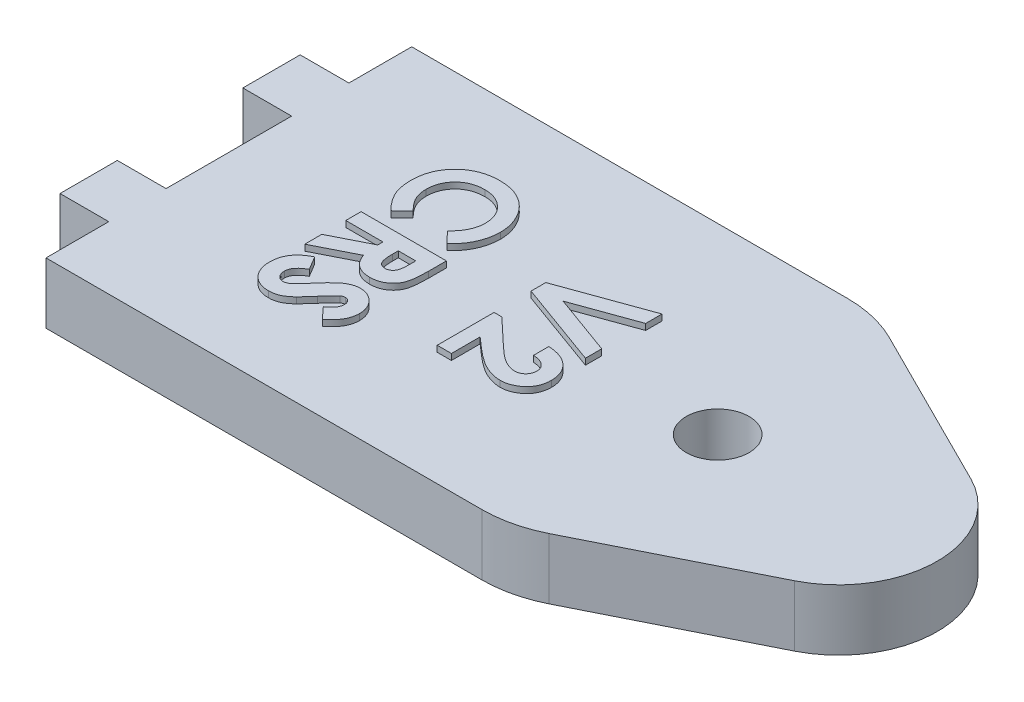
from build123d import *

# Parameters (mm, degrees)
BOSS_EXTRUDE2_DEPTH = 10
CUT_EXTRUDE2_DEPTH  = 10
FILLET3_R           = 16
SKETCH8_W           = 8
SKETCH8_H           = 0.3
CUT_EXTRUDE5_DEPTH  = 10
BOSS_EXTRUDE3_DEPTH = 10
FILLET4_R           = 20
SKETCH12_R          = 5.15
CUT_EXTRUDE6_DEPTH  = 10
BOSS_EXTRUDE4_DEPTH = 1


with BuildPart() as part:
    # Sketch1 → Boss-Extrude2 (new body)
    with BuildSketch(Plane(origin=(0, 0, 0), x_dir=(1, 0, 0), z_dir=(0, 1, 0))):
        Polygon((0, 0), (0, 10), (-8, 10), (-8, 20), (0, 20), (0, 40), (-8, 40), (-8, 50), (0, 50), (0, 60), (50, 60), (90, 40), (90, 20), (50, 0), align=None)
    extrude(amount=BOSS_EXTRUDE2_DEPTH)

    # Sketch5 → Cut-Extrude2 (cut)
    with BuildSketch(Plane(origin=(0, 10, 0), x_dir=(1, 0, 0), z_dir=(0, 1, 0))):
        with BuildLine():
            Line((90, 20), (90, 30))
            ThreePointArc((90, 30), (87.583479317, 21.493491916), (81.05572809, 15.527864045))
            Line((81.05572809, 15.527864045), (90, 20))
        make_face()
        with BuildLine():
            Line((90, 40), (81.05572809, 44.472135955))
            ThreePointArc((81.05572809, 44.472135955), (87.583479317, 38.506508084), (90, 30))
            Line((90, 30), (90, 40))
        make_face()
    extrude(amount=-CUT_EXTRUDE2_DEPTH, mode=Mode.SUBTRACT)

    # Fillet3
    fillet3_edges = [part.edges().sort_by_distance(p)[0] for p in [
        (50, 5, -60),
        (50, 5, 0),
    ]]
    fillet(fillet3_edges, radius=FILLET3_R)

    # Sketch8 → Cut-Extrude5 (cut)
    with BuildSketch(Plane(origin=(0, 10, 0), x_dir=(1, 0, 0), z_dir=(0, 1, 0))):
        with Locations((-4, 49.85)):
            Rectangle(SKETCH8_W, SKETCH8_H)
        with Locations((-4, 40.15)):
            Rectangle(SKETCH8_W, SKETCH8_H)
        with Locations((-4, 19.85)):
            Rectangle(SKETCH8_W, SKETCH8_H)
        with Locations((-4, 10.15)):
            Rectangle(SKETCH8_W, SKETCH8_H)
    extrude(amount=-CUT_EXTRUDE5_DEPTH, mode=Mode.SUBTRACT)

    # Sketch11 → Boss-Extrude3 (add)
    with BuildSketch(Plane.XZ):
        with BuildLine():
            Line((46.22291236, 0), (76.22291236, 0))
            Line((76.22291236, 0), (107.27864045, -15.527864045))
            ThreePointArc((107.27864045, -15.527864045), (116.22291236, -30), (107.27864045, -44.472135955))
            Line((107.27864045, -44.472135955), (76.22291236, -60))
            Line((76.22291236, -60), (46.22291236, -60))
            Line((46.22291236, -60), (46.22291236, 0))
        make_face()
    extrude(amount=-BOSS_EXTRUDE3_DEPTH)

    # Fillet4
    fillet4_edges = [part.edges().sort_by_distance(p)[0] for p in [
        (76.22291236, 5, 0),
        (76.22291236, 5, -60),
    ]]
    fillet(fillet4_edges, radius=FILLET4_R)

    # Sketch12 → Cut-Extrude6 (cut)
    with BuildSketch(Plane(origin=(0, 10, 0), x_dir=(1, 0, 0), z_dir=(0, 1, 0))):
        with Locations((80.20291236, 30)):
            Circle(SKETCH12_R)
    extrude(amount=-CUT_EXTRUDE6_DEPTH, mode=Mode.SUBTRACT)

    # Sketch13 → Boss-Extrude4 (add)
    # profile 1 of 5: a face of its own
    with BuildSketch(Plane(origin=(0, 10, 0), x_dir=(1, 0, 0), z_dir=(0, 1, 0))):
        Polygon((59.505371797, 41.564456878), (59.505371797, 38.880562647), (49.560660259, 35.282405596), (59.505371797, 31.675835083), (59.505371797, 29.000354313), (45.505371797, 34.076476108), (45.505371797, 36.496748544), align=None)
    # profile 2 of 5: a face of its own
    with BuildSketch(Plane(origin=(0, 10, 0), x_dir=(1, 0, 0), z_dir=(0, 1, 0))):
        with BuildLine():
            Line((54.83870513, 25.141379954), (54.83870513, 27.654200467))
            add(Edge.make_bspline(
                [(54.83870513, 27.654200467), (55.028786708, 27.643347981), (55.400194699, 27.622142874), (55.939676698, 27.537794318), (56.449427863, 27.424770149), (56.92766503, 27.27392439), (57.374214421, 27.084376824), (57.790598349, 26.861004999), (58.174624543, 26.59810227), (58.524441011, 26.301264074), (58.838264593, 25.975529906), (59.116520296, 25.627662327), (59.346129899, 25.252340234), (59.535077344, 24.856421069), (59.686037574, 24.439972247), (59.786966703, 23.999053511), (59.855316898, 23.537482572), (59.861297815, 23.221499887), (59.864346156, 23.060450467)],
                knots=[0, 0, 0, 0, 1.199038563, 2.342849363, 3.436047546, 4.486744587, 5.497670872, 6.488682221, 7.459191391, 8.424610317, 9.374430501, 10.305433194, 11.225809216, 12.140057399, 13.06607119, 14.010487599, 14.985989317, 16, 16, 16, 16], degree=3))
            add(Edge.make_bspline(
                [(59.864346156, 23.060450467), (59.858167788, 22.862768929), (59.846106166, 22.47684824), (59.74352409, 21.916001983), (59.570933664, 21.391710381), (59.332186737, 20.903957215), (59.027478674, 20.458597505), (58.660982614, 20.058532413), (58.233974145, 19.706260718), (57.75516208, 19.408525065), (57.247369119, 19.165188602), (56.724427945, 18.991171965), (56.197236124, 18.877550655), (55.842336951, 18.865376562), (55.666028848, 18.859328672)],
                knots=[0, 0, 0, 0, 1.075208937, 2.099059817, 3.090102131, 4.070747506, 5.044426497, 6.016695572, 7.013986309, 8.047248753, 9.078128699, 10.07077592, 11.041593041, 12, 12, 12, 12], degree=3))
            add(Edge.make_bspline(
                [(55.666028848, 18.859328672), (55.55938108, 18.861677464), (55.344725467, 18.866405002), (55.019898842, 18.899276209), (54.689024935, 18.948589494), (54.352387504, 19.022941992), (54.00989193, 19.115665345), (53.660514233, 19.228153374), (53.306231368, 19.363009651), (52.943071275, 19.518005968), (52.569793439, 19.702842389), (52.181055864, 19.918365421), (51.775712952, 20.169040669), (51.35672672, 20.457589385), (50.915015483, 20.772300735), (50.461951729, 21.128100478), (49.990115024, 21.514573458), (49.674922053, 21.789164361), (49.512983977, 21.930242134)],
                knots=[0, 0, 0, 0, 0.728291422, 1.465870735, 2.227967504, 3.011895603, 3.818808047, 4.650669213, 5.517493715, 6.406970765, 7.346374078, 8.360901659, 9.441709605, 10.599840149, 11.834858619, 13.145178554, 14.533265854, 16, 16, 16, 16], degree=3))
            Line((49.512983977, 21.930242134), (47.83870513, 23.391379954))
            Line((47.83870513, 23.391379954), (47.83870513, 18.679841493))
            Line((47.83870513, 18.679841493), (45.505371797, 18.679841493))
            Line((45.505371797, 18.679841493), (45.505371797, 28.013174826))
            Line((45.505371797, 28.013174826), (46.778608977, 28.013174826))
            Line((46.778608977, 28.013174826), (51.19006731, 23.868142775))
            add(Edge.make_bspline(
                [(51.19006731, 23.868142775), (51.318750919, 23.748133445), (51.567972909, 23.515710963), (51.933981915, 23.184997723), (52.281315725, 22.885731455), (52.613672744, 22.624117687), (52.920272662, 22.386427266), (53.210356784, 22.18325879), (53.481302644, 22.012753425), (53.808016031, 21.827645669), (54.197679884, 21.651854149), (54.64658862, 21.490554791), (55.075641985, 21.39223167), (55.35522238, 21.37865997), (55.489346156, 21.372149185)],
                knots=[0, 0, 0, 0, 1.246127091, 2.413378631, 3.493388633, 4.492180848, 5.408488754, 6.240484944, 6.999099869, 7.674939598, 8.898438119, 10.020720584, 11.050475521, 12, 12, 12, 12], degree=3))
            add(Edge.make_bspline(
                [(55.489346156, 21.372149185), (55.619139166, 21.376941127), (55.870633933, 21.386226282), (56.227343096, 21.490805999), (56.552757691, 21.647283095), (56.832054187, 21.874458171), (57.063565005, 22.148652679), (57.233213337, 22.467312262), (57.332923705, 22.82458608), (57.345206806, 23.074774201), (57.351525643, 23.203479313)],
                knots=[0, 0, 0, 0, 1.061596218, 2.057012874, 3.024113775, 4.006148568, 4.986025304, 5.949989669, 6.945406325, 8, 8, 8, 8], degree=3))
            add(Edge.make_bspline(
                [(57.351525643, 23.203479313), (57.349174364, 23.269956901), (57.344545493, 23.400828709), (57.313732353, 23.593200037), (57.25942741, 23.776255176), (57.18666643, 23.952031632), (57.090221228, 24.118653473), (56.971337151, 24.275700425), (56.833035313, 24.424827176), (56.675748167, 24.565349772), (56.500215665, 24.693243678), (56.308040939, 24.806838578), (56.099343276, 24.90076265), (55.876877805, 24.983456817), (55.638255066, 25.047234515), (55.384903188, 25.093672591), (55.117234342, 25.128976359), (54.93323718, 25.137170208), (54.83870513, 25.141379954)],
                knots=[0, 0, 0, 0, 0.903469896, 1.778625579, 2.63899355, 3.493148037, 4.358286772, 5.247621495, 6.164656832, 7.118446693, 8.109501108, 9.111810964, 10.146451449, 11.215617525, 12.33435995, 13.498009769, 14.714554818, 16, 16, 16, 16], degree=3))
        make_face()
    # profile 3 of 5: a face of its own
    with BuildSketch(Plane(origin=(0, 10, 0), x_dir=(1, 0, 0), z_dir=(0, 1, 0))):
        with BuildLine():
            Line((31.845916669, 33.936251749), (30.08469872, 35.778799826))
            add(Edge.make_bspline(
                [(30.08469872, 35.778799826), (30.246520663, 35.934932404), (30.563124164, 36.240404702), (30.978055356, 36.734726681), (31.32923085, 37.244212545), (31.621325956, 37.765436276), (31.844150608, 38.306441714), (32.004350008, 38.860108353), (32.10410361, 39.429446), (32.115174631, 39.814054698), (32.120756412, 40.007966493)],
                knots=[0, 0, 0, 0, 1.115306757, 2.182089883, 3.196083701, 4.1824169, 5.141279108, 6.092660653, 7.038358735, 8, 8, 8, 8], degree=3))
            add(Edge.make_bspline(
                [(32.120756412, 40.007966493), (32.116273706, 40.16989101), (32.107427578, 40.489431204), (32.042576738, 40.958599943), (31.932295061, 41.40738409), (31.780306482, 41.837319903), (31.583641327, 42.247142278), (31.342451811, 42.637710457), (31.058916218, 43.008061513), (30.734501574, 43.35330332), (30.380054196, 43.669118393), (30.00185969, 43.948161119), (29.600784477, 44.181904163), (29.180890353, 44.373733277), (28.740233839, 44.523160741), (28.279111604, 44.629870725), (27.796974487, 44.691588927), (27.469221266, 44.700800783), (27.302647438, 44.705482519)],
                knots=[0, 0, 0, 0, 1.035432265, 2.043311493, 3.022114605, 3.98653278, 4.95457646, 5.923598177, 6.917315552, 7.932509744, 8.948865224, 9.949768934, 10.933144597, 11.912367597, 12.897413939, 13.903909035, 14.934704909, 16, 16, 16, 16], degree=3))
            add(Edge.make_bspline(
                [(27.302647438, 44.705482519), (27.185733678, 44.704135014), (26.955294255, 44.701479055), (26.614420633, 44.672343118), (26.283653024, 44.625558079), (25.963676969, 44.557388158), (25.653254389, 44.473665831), (25.352468658, 44.369616281), (25.061500504, 44.246047475), (24.780898646, 44.106460209), (24.513900621, 43.948922478), (24.260444474, 43.775080938), (24.023757302, 43.583232069), (23.795742645, 43.382339056), (23.590016163, 43.158793077), (23.39465026, 42.922979087), (23.216288374, 42.669875857), (23.050091482, 42.405146654), (22.905733718, 42.126393332), (22.774968228, 41.841209102), (22.668768502, 41.545261882), (22.583161489, 41.242157172), (22.510365607, 40.932977579), (22.465542924, 40.614699197), (22.431599238, 40.290081059), (22.429503413, 40.070693686), (22.42844872, 39.960290211)],
                knots=[0, 0, 0, 0, 1.103757074, 2.175527871, 3.227929046, 4.25632503, 5.262816555, 6.262237806, 7.259082723, 8.246028863, 9.219500025, 10.184246818, 11.145149257, 12.095245763, 13.050780899, 14.010384931, 14.985255937, 15.972438916, 16.959582425, 17.947317807, 18.933039374, 19.924907969, 20.920697008, 21.929431285, 22.958016685, 24, 24, 24, 24], degree=3))
            add(Edge.make_bspline(
                [(22.42844872, 39.960290211), (22.433873442, 39.773029688), (22.444531611, 39.405111455), (22.527637887, 38.865091531), (22.665180162, 38.349844984), (22.825977628, 37.937506755), (22.985182132, 37.615026594), (23.134494861, 37.371739367), (23.298642307, 37.118490096), (23.48774224, 36.86088033), (23.69810034, 36.596093587), (23.934612991, 36.328975741), (24.189408887, 36.052638195), (24.371265275, 35.871614187), (24.464506412, 35.778799826)],
                knots=[0, 0, 0, 0, 1.404522537, 2.759521553, 4.088271485, 5.398566954, 6.072955186, 6.783849712, 7.538645654, 8.336900766, 9.180343671, 10.075042757, 11.013038782, 12, 12, 12, 12], degree=3))
            Line((24.464506412, 35.778799826), (22.588304489, 33.992341493))
            add(Edge.make_bspline(
                [(22.588304489, 33.992341493), (22.467062477, 34.117919897), (22.230423997, 34.363022084), (21.894419518, 34.732751957), (21.592481843, 35.102016412), (21.313653339, 35.461895227), (21.066052212, 35.818282061), (20.849447735, 36.171144421), (20.658303683, 36.516469297), (20.496044932, 36.861492367), (20.357391094, 37.20895245), (20.2404573, 37.566301687), (20.138382112, 37.933710823), (20.058054203, 38.314222753), (19.992661725, 38.70613967), (19.949451815, 39.110720945), (19.919488462, 39.52607624), (19.91692546, 39.806922854), (19.915628207, 39.949072262)],
                knots=[0, 0, 0, 0, 1.244537013, 2.429070097, 3.56066612, 4.644477994, 5.67429546, 6.652817684, 7.595405349, 8.486886006, 9.369351459, 10.26090686, 11.166404474, 12.086719576, 13.0323422, 13.998023148, 14.9867073, 16, 16, 16, 16], degree=3))
            add(Edge.make_bspline(
                [(19.915628207, 39.949072262), (19.92229595, 40.210173053), (19.93534287, 40.721074722), (20.031678928, 41.469859982), (20.194250932, 42.181776015), (20.421049042, 42.858102027), (20.715545181, 43.496768179), (21.072882408, 44.099777338), (21.49645224, 44.666125307), (21.979943874, 45.190938719), (22.514032133, 45.66550868), (23.087276653, 46.085447755), (23.703794048, 46.431293549), (24.35037812, 46.72472593), (25.037137472, 46.944608926), (25.757866445, 47.104664366), (26.51565793, 47.202057267), (27.033126259, 47.212816005), (27.297038464, 47.218303031)],
                knots=[0, 0, 0, 0, 1.07798487, 2.109316747, 3.111276023, 4.08905949, 5.049398091, 6.009992678, 6.978127636, 7.964347882, 8.951383687, 9.924270623, 10.892397886, 11.86520058, 12.851549246, 13.863953586, 14.910602472, 16, 16, 16, 16], degree=3))
            add(Edge.make_bspline(
                [(27.297038464, 47.218303031), (27.469148197, 47.215883415), (27.810227624, 47.211088327), (28.313120589, 47.164691275), (28.801926179, 47.091714896), (29.275140707, 46.991364908), (29.735401133, 46.86190892), (30.179676487, 46.702806572), (30.609807735, 46.513354943), (31.023044597, 46.294390063), (31.421677426, 46.051966384), (31.798754632, 45.780011679), (32.158331913, 45.486858332), (32.495729181, 45.165279133), (32.812273806, 44.819653081), (33.111847422, 44.450932291), (33.388837562, 44.054660898), (33.644604875, 43.636537138), (33.878237868, 43.203125814), (34.07911854, 42.757457783), (34.251822669, 42.303631681), (34.392346678, 41.841842045), (34.498055808, 41.369948849), (34.577904597, 40.891759565), (34.622577381, 40.403312255), (34.629887052, 40.075358365), (34.633576925, 39.909809442)],
                knots=[0, 0, 0, 0, 1.072042128, 2.124525481, 3.143421661, 4.149789678, 5.136208088, 6.119957821, 7.087418232, 8.061778743, 9.031690376, 9.991741907, 10.955971237, 11.919971873, 12.892764515, 13.874218568, 14.877632952, 15.902487591, 16.926514439, 17.94307752, 18.945815567, 19.949956505, 20.947454389, 21.956649761, 22.968530506, 24, 24, 24, 24], degree=3))
            add(Edge.make_bspline(
                [(34.633576925, 39.909809442), (34.631461333, 39.768579513), (34.627252145, 39.487588053), (34.592163983, 39.069144617), (34.53705838, 38.654047696), (34.453915759, 38.243783464), (34.355214963, 37.835417291), (34.225979883, 37.434315568), (34.081923033, 37.034150697), (33.909732484, 36.64119867), (33.721770945, 36.254910984), (33.508521753, 35.884337036), (33.283108026, 35.523254924), (33.032188791, 35.179666011), (32.764865355, 34.847134136), (32.479890504, 34.527398137), (32.172512872, 34.223263886), (31.95533243, 34.032406117), (31.845916669, 33.936251749)],
                knots=[0, 0, 0, 0, 0.996412454, 1.982464992, 2.961075852, 3.949442424, 4.934965278, 5.923860011, 6.921385422, 7.934793307, 8.949617135, 9.951082467, 10.950285876, 11.951772932, 12.951063433, 13.960125323, 14.972308753, 16, 16, 16, 16], degree=3))
        make_face()
    # profile 4 of 5: a face of its own
    with BuildSketch(Plane(origin=(0, 10, 0), x_dir=(1, 0, 0), z_dir=(0, 1, 0))):
        with BuildLine():
            Line((34.274602566, 31.423431237), (34.274602566, 28.495546621))
            add(Edge.make_bspline(
                [(34.274602566, 28.495546621), (34.273917747, 28.30201403), (34.272600647, 27.929796341), (34.251728366, 27.393083723), (34.222815484, 26.900021837), (34.178153218, 26.449036281), (34.120399602, 26.041911388), (34.050332726, 25.677784872), (33.971176219, 25.356445291), (33.874157646, 25.07355272), (33.762430012, 24.8189605), (33.636321652, 24.58230926), (33.491067351, 24.359427505), (33.332552736, 24.146224286), (33.155100384, 23.94650517), (32.960148335, 23.760823531), (32.7491018, 23.586791818), (32.523229854, 23.424179727), (32.282847816, 23.27947354), (32.031368915, 23.151270997), (31.768113596, 23.045940569), (31.494588938, 22.958237367), (31.210466025, 22.89071124), (30.915929324, 22.844863495), (30.610853628, 22.810963286), (30.403574875, 22.809031862), (30.297839746, 22.808046621)],
                knots=[0, 0, 0, 0, 1.749037589, 3.363891962, 4.853828513, 6.212420965, 7.458679178, 8.568887289, 9.562757098, 10.447168552, 11.268163578, 12.073310924, 12.867792413, 13.67045336, 14.472446998, 15.279188696, 16.101356728, 16.943088626, 17.792208908, 18.634830833, 19.491484118, 20.351879174, 21.228996054, 22.12769993, 23.044919519, 24, 24, 24, 24], degree=3))
            add(Edge.make_bspline(
                [(30.297839746, 22.808046621), (30.187478711, 22.81062247), (29.971080837, 22.81567324), (29.65321001, 22.842879434), (29.349093436, 22.89260381), (29.059621532, 22.967918613), (28.781191482, 23.054483195), (28.518940495, 23.169591885), (28.269054511, 23.299503419), (28.035068261, 23.453795552), (27.811784443, 23.62312363), (27.607757889, 23.820048623), (27.412022943, 24.031812815), (27.236839779, 24.270320245), (27.070363145, 24.525057282), (26.91949098, 24.801085284), (26.780430705, 25.096602797), (26.70288109, 25.304366243), (26.663224361, 25.410610724)],
                knots=[0, 0, 0, 0, 1.099860209, 2.156625411, 3.176576793, 4.16617041, 5.135385252, 6.078461593, 7.016046972, 7.938469504, 8.868247731, 9.803980173, 10.76021508, 11.73834243, 12.748633912, 13.790971185, 14.870363756, 16, 16, 16, 16], degree=3))
            Line((26.663224361, 25.410610724), (20.274602566, 22.179841493))
            Line((20.274602566, 22.179841493), (20.274602566, 24.973110724))
            Line((20.274602566, 24.973110724), (26.377166669, 28.058046621))
            Line((26.377166669, 28.058046621), (26.377166669, 28.910610724))
            Line((26.377166669, 28.910610724), (20.274602566, 28.910610724))
            Line((20.274602566, 28.910610724), (20.274602566, 31.423431237))
            Line((20.274602566, 31.423431237), (34.274602566, 31.423431237))
        make_face()
        with BuildLine():
            Line((28.889987182, 28.910610724), (28.889987182, 27.931844698))
            add(Edge.make_bspline(
                [(28.889987182, 27.931844698), (28.891334879, 27.812182396), (28.89391543, 27.5830548), (28.905885526, 27.253539528), (28.934726073, 26.954260013), (28.97116884, 26.683935653), (29.013235346, 26.441191399), (29.073559734, 26.228239622), (29.138081089, 26.041649268), (29.218648721, 25.884099403), (29.308660406, 25.748943107), (29.41542757, 25.635654523), (29.532385335, 25.535851355), (29.666895081, 25.457564887), (29.81344597, 25.394314466), (29.974795216, 25.355088597), (30.148021397, 25.323966585), (30.268696716, 25.321927981), (30.331493592, 25.320867134)],
                knots=[0, 0, 0, 0, 1.688935225, 3.233948049, 4.651771667, 5.929878493, 7.083962697, 8.124219224, 9.050753627, 9.864999381, 10.615157594, 11.334035464, 12.05533055, 12.777108108, 13.522027315, 14.29964284, 15.115170198, 16, 16, 16, 16], degree=3))
            add(Edge.make_bspline(
                [(30.331493592, 25.320867134), (30.405690205, 25.32371725), (30.551435703, 25.329315776), (30.761255235, 25.384873627), (30.955468721, 25.473302819), (31.133144313, 25.594540117), (31.289067647, 25.747128712), (31.425396294, 25.921940231), (31.535709854, 26.121553533), (31.60636013, 26.307696195), (31.649786358, 26.478224476), (31.680613368, 26.631620576), (31.70451542, 26.809736804), (31.727654365, 27.011579284), (31.743581483, 27.238016028), (31.754850736, 27.488628839), (31.75952673, 27.763559353), (31.761008633, 27.955215068), (31.761782053, 28.055242134)],
                knots=[0, 0, 0, 0, 1.020213939, 2.004021227, 2.966357326, 3.948562114, 4.950324333, 5.960000531, 6.991850424, 8.080015304, 8.69218159, 9.414443227, 10.233931419, 11.166782034, 12.212677862, 13.359889063, 14.622099264, 16, 16, 16, 16], degree=3))
            Line((31.761782053, 28.055242134), (31.761782053, 28.910610724))
            Line((31.761782053, 28.910610724), (28.889987182, 28.910610724))
        make_face(mode=Mode.SUBTRACT)
    # profile 5 of 5: a face of its own
    with BuildSketch(Plane(origin=(0, 10, 0), x_dir=(1, 0, 0), z_dir=(0, 1, 0))):
        with BuildLine():
            Line((32.404009618, 12.936251749), (30.684858977, 14.81525816))
            add(Edge.make_bspline(
                [(30.684858977, 14.81525816), (30.798416766, 14.895731249), (31.016431886, 15.050228359), (31.308040587, 15.300903783), (31.558436443, 15.5500816), (31.760460347, 15.802856502), (31.923095955, 16.054876502), (32.035272292, 16.311495897), (32.107413565, 16.569762459), (32.116353153, 16.74336885), (32.120756412, 16.828879954)],
                knots=[0, 0, 0, 0, 1.299459705, 2.494781419, 3.587730629, 4.594196874, 5.512431013, 6.380462003, 7.202284646, 8, 8, 8, 8], degree=3))
            add(Edge.make_bspline(
                [(32.120756412, 16.828879954), (32.117959389, 16.908635565), (32.112559071, 17.062622694), (32.058880315, 17.282142771), (31.966238666, 17.477035821), (31.845101916, 17.647111639), (31.699160216, 17.781836778), (31.546104898, 17.889404355), (31.37716644, 17.949973939), (31.261132693, 17.957946088), (31.203689105, 17.961892775)],
                knots=[0, 0, 0, 0, 1.185010067, 2.2879431, 3.333075148, 4.379039566, 5.372662701, 6.27520591, 7.14612461, 8, 8, 8, 8], degree=3))
            add(Edge.make_bspline(
                [(31.203689105, 17.961892775), (31.145417155, 17.959419587), (31.028065545, 17.954438929), (30.856072146, 17.906332553), (30.688014574, 17.833822509), (30.585709933, 17.764536202), (30.533416669, 17.729120339)],
                knots=[0, 0, 0, 0, 0.967525499, 1.948461899, 2.951351359, 4, 4, 4, 4], degree=3))
            add(Edge.make_bspline(
                [(30.533416669, 17.729120339), (30.492774553, 17.69691878), (30.399221771, 17.622795045), (30.250916901, 17.481586679), (30.070456482, 17.304006957), (29.858828999, 17.08640882), (29.618791648, 16.829059232), (29.348940377, 16.52968058), (29.047581414, 16.192502595), (28.837441914, 15.953117812), (28.727326925, 15.827678031)],
                knots=[0, 0, 0, 0, 0.473868417, 1.090782513, 1.870421581, 2.78911798, 3.865477667, 5.087766164, 6.473963263, 8, 8, 8, 8], degree=3))
            add(Edge.make_bspline(
                [(28.727326925, 15.827678031), (28.625405872, 15.70991143), (28.431980886, 15.486414886), (28.157445176, 15.168423687), (27.910452092, 14.888962384), (27.694708471, 14.643959863), (27.507950669, 14.437130125), (27.349285986, 14.267603655), (27.221803331, 14.133309975), (27.14480373, 14.056971882), (27.11194231, 14.024392775)],
                knots=[0, 0, 0, 0, 1.543621617, 2.929473131, 4.163658386, 5.240097082, 6.164993805, 6.925417477, 7.541396219, 8, 8, 8, 8], degree=3))
            add(Edge.make_bspline(
                [(27.11194231, 14.024392775), (26.978230422, 13.900723969), (26.721189215, 13.662989094), (26.321677405, 13.354811597), (25.934346372, 13.097313695), (25.547294901, 12.900193538), (25.155873941, 12.755904857), (24.753343578, 12.650224539), (24.332794817, 12.587819851), (24.045908932, 12.580818576), (23.900804489, 12.57727739)],
                knots=[0, 0, 0, 0, 1.20648512, 2.3192881, 3.339983362, 4.284774958, 5.190427137, 6.099526693, 7.038756749, 8, 8, 8, 8], degree=3))
            add(Edge.make_bspline(
                [(23.900804489, 12.57727739), (23.759411909, 12.579785119), (23.481994403, 12.584705377), (23.07601638, 12.644903848), (22.687549808, 12.730866016), (22.320486556, 12.863323659), (21.970475826, 13.026124268), (21.637402887, 13.224539939), (21.329032477, 13.467119178), (21.037086962, 13.73656802), (20.774909831, 14.039212272), (20.544231446, 14.364847557), (20.347931267, 14.712865811), (20.192462854, 15.084565436), (20.067620513, 15.477671156), (19.978908799, 15.892679923), (19.924089862, 16.330077087), (19.918489398, 16.62866151), (19.915628207, 16.781203672)],
                knots=[0, 0, 0, 0, 1.043082113, 2.046565928, 3.024368146, 3.976196322, 4.921091788, 5.871642728, 6.831173094, 7.81279273, 8.801063391, 9.781590382, 10.755046466, 11.74476232, 12.751114423, 13.796272686, 14.874149815, 16, 16, 16, 16], degree=3))
            add(Edge.make_bspline(
                [(19.915628207, 16.781203672), (19.917751721, 16.900940989), (19.921957495, 17.138089546), (19.956315637, 17.487605694), (20.011712693, 17.825122093), (20.091299445, 18.15017003), (20.191224455, 18.463712552), (20.315575137, 18.765458221), (20.461937351, 19.055087524), (20.630394349, 19.334465393), (20.825884566, 19.60166616), (21.044343105, 19.860282113), (21.290505502, 20.107082991), (21.559570908, 20.347130683), (21.85843481, 20.571937508), (22.178476019, 20.793030168), (22.527239014, 20.999706652), (22.771854115, 21.127425866), (22.896798079, 21.192662006)],
                knots=[0, 0, 0, 0, 1.016957334, 2.014158747, 2.980235577, 3.920141478, 4.854360818, 5.773095257, 6.689355356, 7.608638744, 8.541033765, 9.498850575, 10.481527934, 11.499755671, 12.559141621, 13.65604909, 14.802761907, 16, 16, 16, 16], degree=3))
            Line((22.896798079, 21.192662006), (24.223320515, 18.982726108))
            add(Edge.make_bspline(
                [(24.223320515, 18.982726108), (24.08148846, 18.901130866), (23.809584288, 18.744705812), (23.444246572, 18.479628935), (23.131395293, 18.208071207), (22.876560117, 17.923754457), (22.67633357, 17.63013587), (22.533237788, 17.3257972), (22.444661662, 17.010524625), (22.433844471, 16.795775269), (22.42844872, 16.688655596)],
                knots=[0, 0, 0, 0, 1.283663364, 2.460892379, 3.537111102, 4.529833553, 5.449777664, 6.316464042, 7.160231139, 8, 8, 8, 8], degree=3))
            add(Edge.make_bspline(
                [(22.42844872, 16.688655596), (22.43281331, 16.579679487), (22.441281251, 16.368249964), (22.521040671, 16.065964558), (22.643460859, 15.787603222), (22.821502199, 15.548283164), (23.024521114, 15.345054428), (23.25349448, 15.19936031), (23.498264173, 15.104853626), (23.669067081, 15.095035738), (23.754971156, 15.090097903)],
                knots=[0, 0, 0, 0, 1.13537643, 2.202795631, 3.242191317, 4.290390765, 5.297919085, 6.223733717, 7.106639842, 8, 8, 8, 8], degree=3))
            add(Edge.make_bspline(
                [(23.754971156, 15.090097903), (23.834850808, 15.094719858), (23.997118673, 15.104108917), (24.238524962, 15.172889452), (24.478760682, 15.281316693), (24.677894006, 15.405749688), (24.843879913, 15.535477787), (24.985536664, 15.662636176), (25.145317076, 15.81334086), (25.318864111, 15.991431878), (25.509514526, 16.193445388), (25.716815033, 16.420042741), (25.939075828, 16.673664179), (26.090471501, 16.852931516), (26.169634618, 16.946668416)],
                knots=[0, 0, 0, 0, 0.916057066, 1.860882232, 2.859899639, 3.934694552, 4.546382938, 5.276161949, 6.118633209, 7.067046139, 8.129668089, 9.306861125, 10.591787583, 12, 12, 12, 12], degree=3))
            add(Edge.make_bspline(
                [(26.169634618, 16.946668416), (26.320411214, 17.124859172), (26.609797138, 17.466861166), (27.037124717, 17.950242047), (27.436804874, 18.385499917), (27.812009292, 18.769768266), (28.160423183, 19.104071835), (28.478727485, 19.392459707), (28.773379745, 19.628652255), (29.12296448, 19.876949709), (29.546719194, 20.116657021), (30.059261633, 20.319973503), (30.570646472, 20.45262127), (30.914067058, 20.46742634), (31.083096156, 20.474713288)],
                knots=[0, 0, 0, 0, 1.34561873, 2.582649632, 3.719171478, 4.751946187, 5.678152813, 6.502542634, 7.227205346, 7.853698961, 8.973370308, 10.023159194, 11.027013428, 12, 12, 12, 12], degree=3))
            add(Edge.make_bspline(
                [(31.083096156, 20.474713288), (31.202954341, 20.471671613), (31.439087842, 20.465679188), (31.786327527, 20.41238223), (32.121229927, 20.332361837), (32.443693088, 20.217351579), (32.750148448, 20.063150073), (33.045311917, 19.880793645), (33.328669171, 19.666518219), (33.590981078, 19.417811582), (33.834655467, 19.148010385), (34.048546681, 18.859039951), (34.228433821, 18.553917592), (34.379848347, 18.234801659), (34.493800905, 17.897591256), (34.575296839, 17.545350977), (34.623640911, 17.177979335), (34.630223657, 16.928116069), (34.633576925, 16.800835083)],
                knots=[0, 0, 0, 0, 1.010961173, 1.991702108, 2.958025473, 3.913824419, 4.873522744, 5.847800578, 6.838738273, 7.865764422, 8.893759806, 9.903642949, 10.894078012, 11.878777586, 12.879248405, 13.891624672, 14.925988217, 16, 16, 16, 16], degree=3))
            add(Edge.make_bspline(
                [(34.633576925, 16.800835083), (34.62752636, 16.635891747), (34.61547299, 16.30730708), (34.521715716, 15.821339063), (34.372704845, 15.346441466), (34.197214431, 14.962545028), (34.021710304, 14.659784074), (33.863661556, 14.426967551), (33.681471945, 14.189602288), (33.474415332, 13.946465006), (33.243874557, 13.698791304), (32.985161523, 13.448665187), (32.70670926, 13.189993546), (32.506677107, 13.022314069), (32.404009618, 12.936251749)],
                knots=[0, 0, 0, 0, 1.282867522, 2.555608537, 3.83715526, 5.14906667, 5.830341525, 6.558732832, 7.337173124, 8.157810814, 9.043130442, 9.96912168, 10.957641678, 12, 12, 12, 12], degree=3))
        make_face()
    extrude(amount=BOSS_EXTRUDE4_DEPTH)


solid = part.part
